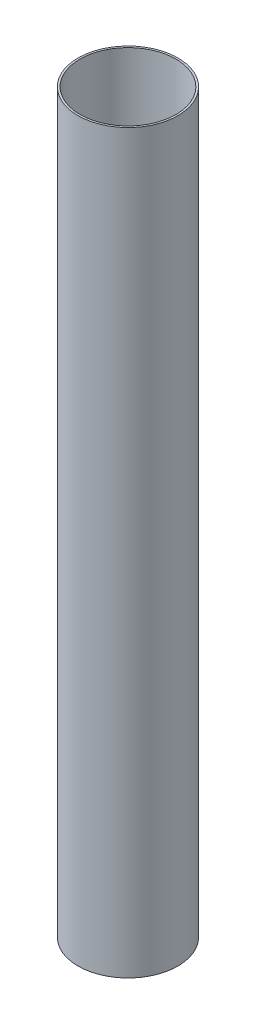
from build123d import *

# Parameters (mm, degrees)
SKETCH1_R           = 39.624
SKETCH1_R_2         = 38.1
BOSS_EXTRUDE1_DEPTH = 584.2


with BuildPart() as part:
    # Sketch1 → Boss-Extrude1 (new body)
    with BuildSketch(Plane(origin=(0, 0, 0), x_dir=(1, 0, 0), z_dir=(0, 1, 0))):
        Circle(SKETCH1_R)
        Circle(SKETCH1_R_2, mode=Mode.SUBTRACT)
    extrude(amount=BOSS_EXTRUDE1_DEPTH)


solid = part.part
